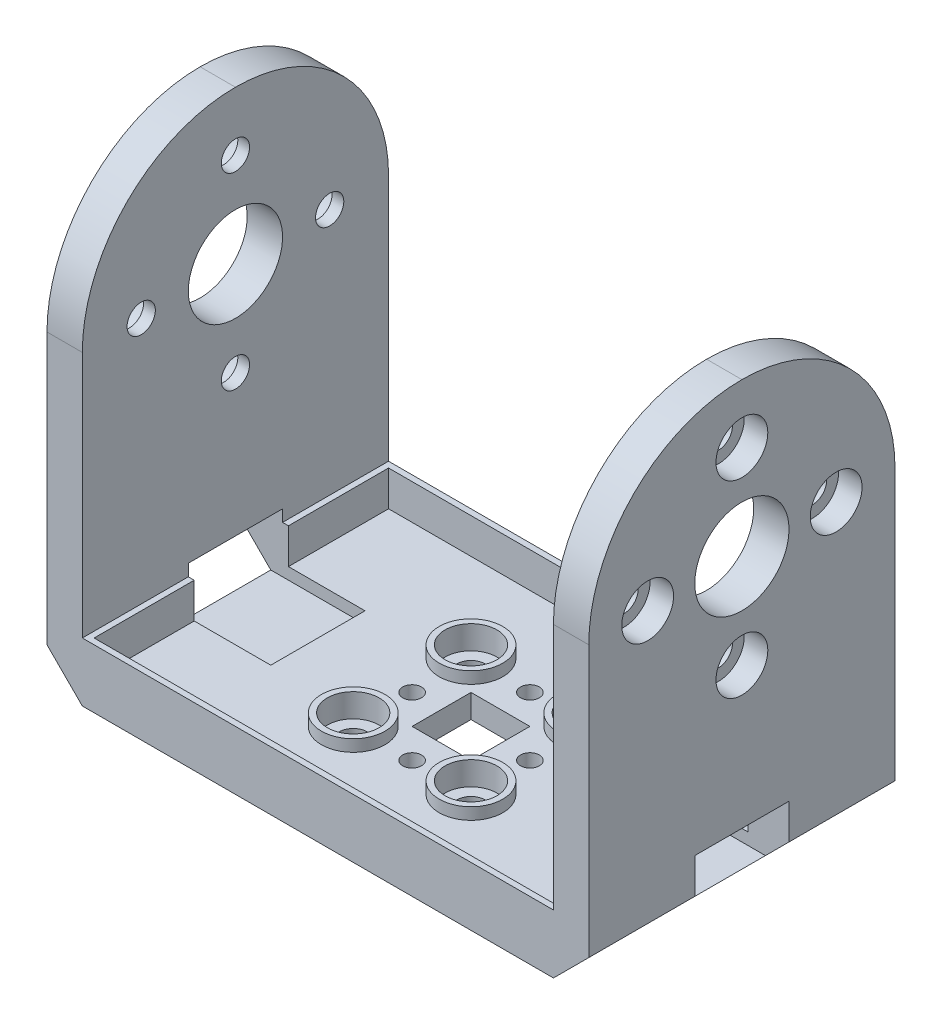
from build123d import *

# Parameters (mm, degrees)
SKETCH_1_W                   = 46
SKETCH_1_H                   = 26
EXTRUDE_1_DEPTH              = 5
SKETCH_2_W                   = 3
SKETCH_2_H                   = 26
EXTRUDE_2_DEPTH              = 34
FILLET_1_R                   = 13
CUT_EXTRUDE_1_REACH          = 63.693
SKETCH_3_R                   = 4
HOLE_WIZARD_M2_1_D           = 2.4
HOLE_WIZARD_M2_1_CBORE_D     = 4.4
HOLE_WIZARD_M2_1_CBORE_DEPTH = 2
SKETCH_6_W                   = 39
SKETCH_6_H                   = 25
CUT_EXTRUDE_3_DEPTH          = 3
CHAMFER_1_SIZE               = 3
SKETCH_7_W                   = 8
SKETCH_7_H                   = 5
CUT_EXTRUDE_4_DEPTH          = 10
SKETCH_8_W                   = 5
SKETCH_8_H                   = 5
CUT_EXTRUDE_5_DEPTH          = 10
SKETCH_9_R                   = 2.7
EXTRUDE_7_DEPTH              = 1
HOLE_WIZARD_M2_2_D           = 2.4
HOLE_WIZARD_M2_2_CBORE_D     = 4.4
HOLE_WIZARD_M2_2_CBORE_DEPTH = 2
M2X0_4_1_D                   = 1.6


with BuildPart() as part:
    # 草图1 → 凸台-拉伸1 (new body)
    with BuildSketch(Plane(origin=(0, 0, 0), x_dir=(1, 0, 0), z_dir=(0, 1, 0))):
        Rectangle(SKETCH_1_W, SKETCH_1_H)
    extrude(amount=EXTRUDE_1_DEPTH)

    # 草图2 → 凸台-拉伸2 (add)
    with BuildSketch(Plane(origin=(0, 5, 0), x_dir=(1, 0, 0), z_dir=(0, 1, 0))):
        with Locations((-21.5, 0)):
            Rectangle(SKETCH_2_W, SKETCH_2_H)
        with Locations((21.5, 0)):
            Rectangle(SKETCH_2_W, SKETCH_2_H)
    extrude(amount=EXTRUDE_2_DEPTH)

    # 圆角1
    fillet_1_edges = [part.edges().sort_by_distance(p)[0] for p in [
        (21.5, 39, -13),
        (-21.5, 39, -13),
        (21.5, 39, 13),
        (-21.5, 39, 13),
    ]]
    fillet(fillet_1_edges, radius=FILLET_1_R - 0.0001)  # a hair under: the kernel refuses the full size

    # 草图3 → 切除-拉伸1 (cut, up to next)
    with BuildSketch(Plane.ZY.offset(23), mode=Mode.PRIVATE) as cut_extrude_1_sk1:
        with Locations((0, 26)):
            Circle(SKETCH_3_R)
    cut_extrude_1_tool1 = extrude(cut_extrude_1_sk1.sketch, amount=-CUT_EXTRUDE_1_REACH, mode=Mode.PRIVATE) & part.part
    cut_extrude_1 = cut_extrude_1_tool1.solids().sort_by_distance((-23, 26, 0))[0]
    add(cut_extrude_1, mode=Mode.SUBTRACT)

    # M2 凹头盖螺钉的柱形沉头孔1 (through all)
    with Locations(Plane(origin=(-23, 26, -8), x_dir=(0, 0, -1), z_dir=(-1, 0, 0))):
        with Locations((0, 0), (-8, -8), (-16, 0), (-8, 8)):
            hole_wizard_m2_1 = CounterBoreHole(HOLE_WIZARD_M2_1_D / 2, HOLE_WIZARD_M2_1_CBORE_D / 2, HOLE_WIZARD_M2_1_CBORE_DEPTH)

    # 镜向1: 切除-拉伸1, M2 凹头盖螺钉的柱形沉头孔1 across plane
    add(cut_extrude_1.mirror(Plane(origin=(0, 0, 0), x_dir=(0, 0, 1), z_dir=(1, 0, 0))), mode=Mode.SUBTRACT)
    add(hole_wizard_m2_1.mirror(Plane(origin=(0, 0, 0), x_dir=(0, 0, 1), z_dir=(1, 0, 0))), mode=Mode.SUBTRACT)

    # 草图6 → 切除-拉伸3 (cut)
    with BuildSketch(Plane(origin=(0, 5, 0), x_dir=(1, 0, 0), z_dir=(0, 1, 0))):
        Rectangle(SKETCH_6_W, SKETCH_6_H)
    extrude(amount=-CUT_EXTRUDE_3_DEPTH, mode=Mode.SUBTRACT)

    # 倒角1
    chamfer_1_edges = [part.edges().sort_by_distance(p)[0] for p in [
        (-23, 0, 0),
        (23, 0, 0),
    ]]
    chamfer(chamfer_1_edges, length=CHAMFER_1_SIZE)

    # 草图7 → 切除-拉伸4 (cut)
    with BuildSketch(Plane(origin=(23, 0, 0), x_dir=(0, 0, -1), z_dir=(1, 0, 0))):
        with Locations((0, 3.5)):
            Rectangle(SKETCH_7_W, SKETCH_7_H)
    cut_extrude_4 = extrude(amount=-CUT_EXTRUDE_4_DEPTH, mode=Mode.SUBTRACT)

    # 镜向2: 切除-拉伸4 across plane
    add(cut_extrude_4.mirror(Plane(origin=(0, 0, 0), x_dir=(0, 0, 1), z_dir=(1, 0, 0))), mode=Mode.SUBTRACT)

    # 草图8 → 切除-拉伸5 (cut)
    with BuildSketch(Plane(origin=(0, 2, 0), x_dir=(1, 0, 0), z_dir=(0, 1, 0))):
        Rectangle(SKETCH_8_W, SKETCH_8_H)
    extrude(amount=-CUT_EXTRUDE_5_DEPTH, mode=Mode.SUBTRACT)

    # 草图9 → 凸台-拉伸7 (add)
    with BuildSketch(Plane(origin=(0, 2, 0), x_dir=(1, 0, 0), z_dir=(0, 1, 0))):
        with Locations(Location((-5, 5, 0), (0, 0, 270))):
            Circle(SKETCH_9_R)
        with Locations(Location((5, 5, 0), (0, 0, 270))):
            Circle(SKETCH_9_R)
        with Locations(Location((5, -5, 0), (0, 0, 270))):
            Circle(SKETCH_9_R)
        with Locations(Location((-5, -5, 0), (0, 0, 270))):
            Circle(SKETCH_9_R)
    extrude(amount=EXTRUDE_7_DEPTH)

    # M2 凹头盖螺钉的柱形沉头孔2 (through all)
    with Locations(Plane(origin=(-5, 3, 5), x_dir=(0, 0, 1), z_dir=(0, 1, 0))):
        with Locations((0, 0), (0, 10), (-10, 10), (-10, 0)):
            CounterBoreHole(HOLE_WIZARD_M2_2_D / 2, HOLE_WIZARD_M2_2_CBORE_D / 2, HOLE_WIZARD_M2_2_CBORE_DEPTH)

    # M2x0.4 螺纹孔1 (through all)
    with Locations(Plane(origin=(-5, 2, 0), x_dir=(0, 0, 1), z_dir=(0, 1, 0))):
        with Locations((0, 0), (-5, 5), (0, 10), (5, 5)):
            Hole(M2X0_4_1_D / 2)


solid = part.part
